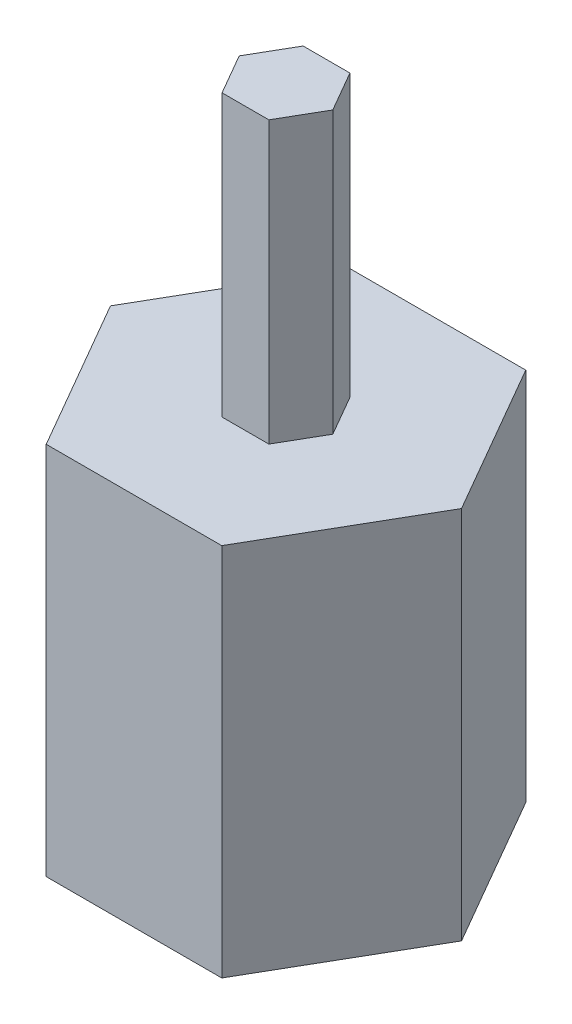
from build123d import *

# Parameters (mm, degrees)
BOSS_EXTRUDE1_DEPTH = 6
BOSS_EXTRUDE2_DEPTH = 8


with BuildPart() as part:
    # Sketch1 → Boss-Extrude1 (new body)
    with BuildSketch(Plane(origin=(0, 0, 0), x_dir=(1, 0, 0), z_dir=(0, 1, 0))):
        Polygon((1, 0), (0.5, 0.866025404), (-0.5, 0.866025404), (-1, 0), (-0.5, -0.866025404), (0.5, -0.866025404), align=None)
    extrude(amount=BOSS_EXTRUDE1_DEPTH)

    # Sketch2 → Boss-Extrude2 (add)
    with BuildSketch(Plane.XZ):
        Polygon((3.75, 0), (1.875, 3.247595264), (-1.875, 3.247595264), (-3.75, 0), (-1.875, -3.247595264), (1.875, -3.247595264), align=None)
    extrude(amount=BOSS_EXTRUDE2_DEPTH)


solid = part.part
